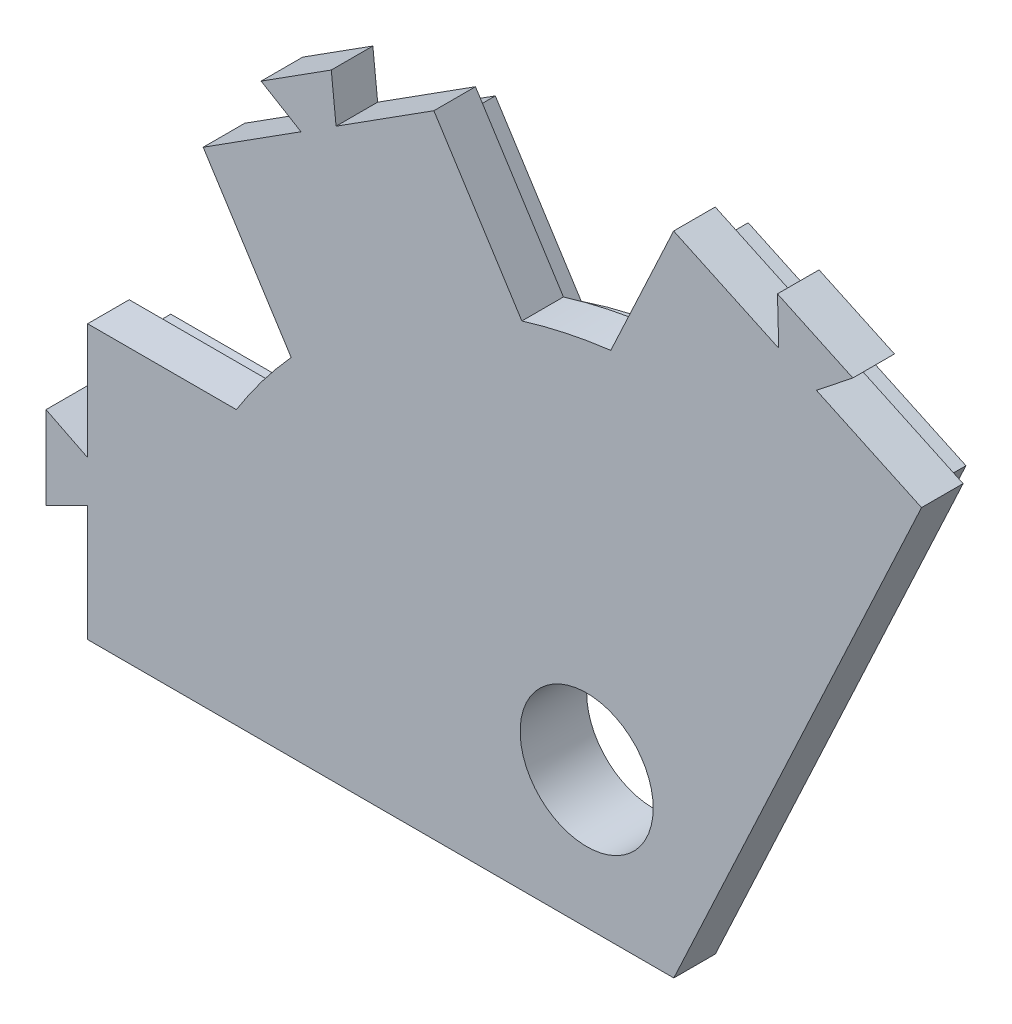
from build123d import *

# Parameters (mm, degrees)
F_1_1_2_2_6_BASE_SUJETADOR_OUTLINE_W   = 26
F_1_1_2_2_6_BASE_SUJETADOR_OUTLINE_H   = 28.884781413
F_1_1_2_2_6_BASE_SUJETADOR_OUTLINE_R   = 8
F_1_1_2_2_6_BASE_SUJETADOR_DEPTH       = 8
F_1_1_2_2_6_BASE_SUJETADOR_START       = 3
F_1_1_2_2_6_BASE_SUJETADOR_2_OUTLINE_W = 26
F_1_1_2_2_6_BASE_SUJETADOR_2_OUTLINE_H = 28.884781413
F_1_1_2_2_6_BASE_SUJETADOR_2_DEPTH     = 5
CROQUIS2_R                             = 8
SALIENTE_EXTRUIR1_DEPTH                = 5
CROQUIS3_R                             = 8
SALIENTE_EXTRUIR2_DEPTH                = 3


# Read off the part's stored shape, not the designer's step: 1.1.2.2.6_Base_Sujetador
with BuildPart() as part:
    # 1.1.2.2.6_Base_Sujetador outline → 1.1.2.2.6_Base_Sujetador (new body)
    with BuildSketch(Plane.XY):
        with Locations((-9.12411578, 30.387347077)):
            Rectangle(F_1_1_2_2_6_BASE_SUJETADOR_OUTLINE_W, F_1_1_2_2_6_BASE_SUJETADOR_OUTLINE_H)
        with Locations((-9.12411578, 30.387347076)):
            Circle(F_1_1_2_2_6_BASE_SUJETADOR_OUTLINE_R, mode=Mode.SUBTRACT)
    extrude(amount=F_1_1_2_2_6_BASE_SUJETADOR_DEPTH)

    # 1.1.2.2.6_Base_Sujetador 2 outline → 1.1.2.2.6_Base_Sujetador 2 (add)
    with BuildSketch(Plane.XY.offset(F_1_1_2_2_6_BASE_SUJETADOR_START)):
        Polygon((-24.12411578, 27.887347076), (-24.12411578, 13.94495637), (5.87588422, 13.94495637), (5.87588422, 46.829737783), (-24.12411578, 46.829737783), (-24.12411578, 32.887347076), (-29.12411578, 35.387347076), (-29.12411578, 25.387347076), align=None)
        with Locations((-9.12411578, 30.387347077)):
            Rectangle(F_1_1_2_2_6_BASE_SUJETADOR_2_OUTLINE_W, F_1_1_2_2_6_BASE_SUJETADOR_2_OUTLINE_H, mode=Mode.SUBTRACT)
    extrude(amount=F_1_1_2_2_6_BASE_SUJETADOR_2_DEPTH)

    # Croquis2 → Saliente-Extruir1 (add)
    # profile 1 of 2: a face of its own
    with BuildSketch(Plane.XY.offset(8)):
        Polygon((-6.240696441, 46.829737783), (-24.12411578, 46.829737783), (-24.12411578, 32.887347076), (-29.12411578, 35.387347076), (-29.12411578, 25.387347076), (-24.12411578, 27.887347076), (-24.12411578, 13.94495637), (5.87588422, 13.94495637), (5.87588422, 46.829737783), align=None)
    # profile 2 of 2: a face of its own
    with BuildSketch(Plane.XY.offset(8)):
        with BuildLine():
            ThreePointArc((0.348971375, 55.551526377), (-3.138373762, 51.336082183), (-6.240696441, 46.829737783))
            Line((-6.240696441, 46.829737783), (5.87588422, 46.829737783))
            Line((5.87588422, 46.829737783), (5.87588422, 13.94495637))
            Line((5.87588422, 13.94495637), (46.350842356, 13.94495637))
            Line((46.350842356, 13.94495637), (63.456298807, 50.627726109))
            Line((63.456298807, 50.627726109), (76.134846658, 77.81695972))
            Line((76.134846658, 77.81695972), (63.498749391, 83.709268645))
            Line((63.498749391, 83.709268645), (67.877610167, 87.184261926))
            Line((67.877610167, 87.184261926), (58.814532297, 91.410444543))
            Line((58.814532297, 91.410444543), (58.967210456, 85.822359953))
            Line((58.967210456, 85.822359953), (46.331113188, 91.714668878))
            Line((46.331113188, 91.714668878), (38.773253593, 75.506786672))
            ThreePointArc((38.773253593, 75.506786672), (33.378020355, 74.599590907), (28.083714716, 73.220506552))
            Line((28.083714716, 73.220506552), (17.505279389, 89.825323912))
            Line((17.505279389, 89.825323912), (5.746386333, 82.334082846))
            Line((5.746386333, 82.334082846), (5.168366906, 87.894289096))
            Line((5.168366906, 87.894289096), (-3.265547552, 82.521293012))
            Line((-3.265547552, 82.521293012), (1.529429104, 79.647584804))
            Line((1.529429104, 79.647584804), (-10.229463952, 72.156343738))
            Line((-10.229463952, 72.156343738), (0.348971375, 55.551526377))
        make_face()
        with Locations((35.87588422, 30.387347076)):
            Circle(CROQUIS2_R, mode=Mode.SUBTRACT)
    extrude(amount=-SALIENTE_EXTRUIR1_DEPTH)

    # Croquis3 → Saliente-Extruir2 (add)
    with BuildSketch(Plane(origin=(0, 0, 3), x_dir=(-1, 0, 0), z_dir=(0, 0, -1))):
        with BuildLine():
            Line((-73.476994561, 76.849580669), (-45.076701834, 15.94495637))
            Line((-45.076701834, 15.94495637), (22.12411578, 15.94495637))
            Line((22.12411578, 15.94495637), (22.12411578, 44.829737783))
            Line((22.12411578, 44.829737783), (5.12054128, 44.829737783))
            ThreePointArc((5.12054128, 44.829737783), (1.416566873, 50.296678088), (-2.865505455, 55.32367712))
            Line((-2.865505455, 55.32367712), (7.468081844, 71.544160063))
            Line((7.468081844, 71.544160063), (-16.893095714, 87.063941804))
            Line((-16.893095714, 87.063941804), (-27.226683013, 70.843458861))
            ThreePointArc((-27.226683013, 70.843458861), (-33.592373346, 72.599832764), (-40.112471141, 73.646344803))
            Line((-40.112471141, 73.646344803), (-47.298492239, 89.05681678))
            Line((-47.298492239, 89.05681678), (-73.476994561, 76.849580669))
        make_face()
        with Locations(Location((-35.87588422, 30.387347076, 0), (0, 0, 180))):
            Circle(CROQUIS3_R, mode=Mode.SUBTRACT)
    extrude(amount=SALIENTE_EXTRUIR2_DEPTH)


solid = part.part
